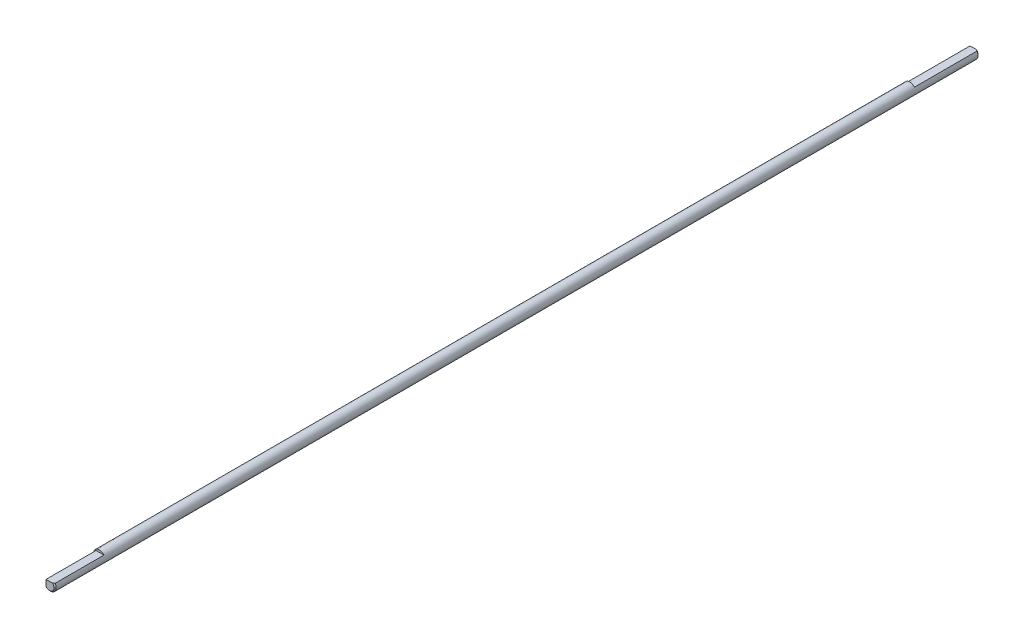
from build123d import *

# Parameters (mm, degrees)
SKETCH_1_R        = 2.5
BODY_DEPTH        = 406.5
CHAMFEREDGES_SIZE = 0.5
SKETCH2_W         = 28.630475487
SKETCH2_H         = 2.50986962
SKETCH2_W_2       = 28
SKETCH2_H_2       = 1.942146438
FIRSTSLOTS_DEPTH  = 407.515374863
CIRPATTERN1_COUNT = 2
CIRPATTERN1_ANGLE = 90


with BuildPart() as part:
    # Эскиз1 → Body (new body)
    with BuildSketch(Plane.XY):
        Circle(SKETCH_1_R)
    extrude(amount=BODY_DEPTH)

    # ChamferEdges
    chamferedges_edges = [part.edges().sort_by_distance(p)[0] for p in [
        (-2.5, 0, 406.5),
        (-2.5, 0, 0),
    ]]
    chamfer(chamferedges_edges, length=CHAMFEREDGES_SIZE)

    # Sketch2 → FirstSlots (cut, symmetric)
    with BuildSketch(Plane(origin=(0, 0, 0), x_dir=(0, 0, -1), z_dir=(1, 0, 0))):
        with Locations((-13.684762257, 2.75493481)):
            Rectangle(SKETCH2_W, SKETCH2_H)
        with Locations((-398.5, 2.471073219)):
            Rectangle(SKETCH2_W_2, SKETCH2_H_2)
    firstslots = extrude(amount=FIRSTSLOTS_DEPTH, both=True, mode=Mode.SUBTRACT)

    # CirPattern1: FirstSlots ×2 about axis
    cirpattern1_axis = Axis((0, 0, 406.5), (0, 0, 1))
    for i in range(1, CIRPATTERN1_COUNT):
        add(firstslots.rotate(cirpattern1_axis, i * CIRPATTERN1_ANGLE / (CIRPATTERN1_COUNT - 1)), mode=Mode.SUBTRACT)


solid = part.part
